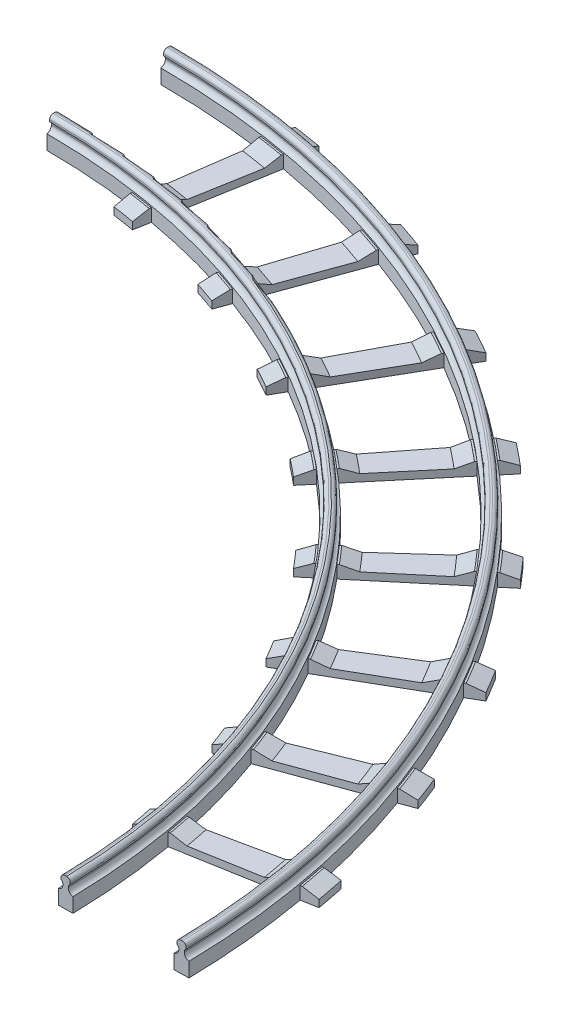
from build123d import *

# Parameters (mm, degrees)
SKETCH_1_W               = 4
SKETCH_1_H               = 21
SKETCH_1_H_2             = 8
EXTRUDE_1_DEPTH          = 4
SKETCH_1_7_W             = 44.5
SKETCH_1_7_H             = 8
EXTRUDE_2_DEPTH          = 3.5
SKETCH_2_W               = 18.5
SKETCH_2_H               = 1.5
CUT_EXTRUDE_1_DEPTH      = 37.7704025
SKETCH_2_3_W             = 2.5
SKETCH_2_3_H             = 1.5
EXTRUDE_4_DEPTH          = 29
FILLET_1_R               = 1
FILLET_2_R               = 1.5
FILLET_3_R               = 1
REVOLVE_2_ANGLE          = 92
CUT_EXTRUDE_5_DEPTH      = 301.959397623
REVOLVE_1_ANGLE          = 2
PATTERN_CIRCULAR_1_COUNT = 10
PATTERN_CIRCULAR_1_ANGLE = 90
CUT_REVOLVE_1_ANGLE      = 1
CUT_REVOLVE_2_ANGLE      = 1
CUT_REVOLVE_3_ANGLE      = 1
CUT_REVOLVE_4_ANGLE      = 1


with BuildPart() as part:
    # 草图1 → 凸台-拉伸1 (new body)
    with BuildSketch(Plane(origin=(0, 0, 0), x_dir=(1, 0, 0), z_dir=(0, 1, 0))):
        with Locations((-15.75, -4)):
            Rectangle(SKETCH_1_W, SKETCH_1_H)
        with Locations((15.75, -4)):
            Rectangle(SKETCH_1_W, SKETCH_1_H)
        with Locations((15.75, 10.5)):
            Rectangle(SKETCH_1_W, SKETCH_1_H_2)
        with Locations((-15.75, 10.5)):
            Rectangle(SKETCH_1_W, SKETCH_1_H_2)
    extrude(amount=EXTRUDE_1_DEPTH)

    # 草图1<7> → 凸台-拉伸2 (add)
    with BuildSketch(Plane(origin=(0, 0, 0), x_dir=(1, 0, 0), z_dir=(0, 1, 0))):
        with Locations((0, 10.5)):
            Rectangle(SKETCH_1_7_W, SKETCH_1_7_H)
    extrude(amount=EXTRUDE_2_DEPTH)

    # 草图2 → 切除-拉伸1 (cut, through all)
    with BuildSketch(Plane(origin=(0, 0, -14.5), x_dir=(-1, 0, 0), z_dir=(0, 0, -1))):
        with Locations((0, 2.75)):
            Rectangle(SKETCH_2_W, SKETCH_2_H)
        Polygon((13.25, 3.5), (9.25, 3.5), (9.25, 2), align=None)
        Polygon((-9.25, 3.5), (-13.25, 3.5), (-9.25, 2), align=None)
        Polygon((-22.25, 3.5), (-22.25, 2), (-18.25, 3.5), align=None)
        Polygon((22.25, 3.5), (18.25, 3.5), (22.25, 2), align=None)
    extrude(amount=-CUT_EXTRUDE_1_DEPTH, mode=Mode.SUBTRACT)

    # 草图2<3> → 凸台-拉伸4 (add, through all)
    with BuildSketch(Plane(origin=(0, 0, -14.5), x_dir=(-1, 0, 0), z_dir=(0, 0, -1))):
        with Locations((-15.75, 7.25)):
            Rectangle(SKETCH_2_3_W, SKETCH_2_3_H)
        Polygon((-15, 6.5), (-16.5, 6.5), (-16.5, 4), (-15.75, 4), (-15, 4), align=None)
        with Locations((15.75, 7.25)):
            Rectangle(SKETCH_2_3_W, SKETCH_2_3_H)
        Polygon((16.5, 6.5), (15, 6.5), (15, 4), (15.75, 4), (16.5, 4), align=None)
    extrude(amount=-EXTRUDE_4_DEPTH)

    # 圆角1
    # the kernel refuses this fillet: 1 mm, written as the material it adds along each edge
    with BuildSketch(Plane(origin=(-16.5, 6.5, -14.5), x_dir=(-1, 0, 0), z_dir=(0, 0, 1)), Plane(origin=(15, 6.5, -14.5), x_dir=(-1, 0, 0), z_dir=(0, 0, 1))) as fillet_1_piece_1:
        with BuildLine():
            CenterArc((1, 0.866025404), FILLET_1_R, 180, 60)
            Line((0, 0.866025404), (-0.02, 0.866025404))
            Line((-0.02, 0.866025404), (-0.02, 0))
            Line((-0.02, 0), (0, -0.02))
            ThreePointArc((0, -0.02), (0.25, -0.02), (0.49, -0.017320508))
            Line((0.49, -0.017320508), (0.5, 0))
        make_face()
    extrude(amount=29)
    with BuildSketch(Plane(origin=(-15, 6.5, -14.5), x_dir=(0, -1, 0), z_dir=(0, 0, 1)), Plane(origin=(16.5, 6.5, -14.5), x_dir=(0, -1, 0), z_dir=(0, 0, 1))) as fillet_1_piece_2:
        with BuildLine():
            CenterArc((0.866025404, 1), FILLET_1_R, 210, 60)
            Line((0, 0.5), (-0.017320508, 0.49))
            ThreePointArc((-0.017320508, 0.49), (-0.02, 0.25), (-0.02, 0))
            Line((-0.02, 0), (0, -0.02))
            Line((0, -0.02), (0.866025404, -0.02))
            Line((0.866025404, -0.02), (0.866025404, 0))
        make_face()
    extrude(amount=29)

    # 圆角2
    # the kernel refuses this fillet: 1.5 mm, written as the material it adds along each edge
    with BuildSketch(Plane(origin=(16.5, 4, -14.5), x_dir=(1, 0, 0), z_dir=(0, 0, 1))) as fillet_2_piece_1:
        with BuildLine():
            CenterArc((1.5, 1.479019946), FILLET_2_R, 180, 80.405931773)
            Line((0, 1.479019946), (-0.03, 1.479019946))
            Line((-0.03, 1.479019946), (-0.03, 0))
            Line((-0.03, 0), (0, -0.03))
            ThreePointArc((0, -0.03), (0.625, -0.03), (1.245, -0.029580399))
            Line((1.245, -0.029580399), (1.25, 0))
        make_face()
    extrude(amount=29)
    with BuildSketch(Plane(origin=(15, 4, -14.5), x_dir=(0, 1, 0), z_dir=(0, 0, 1)), Plane(origin=(-16.5, 4, -14.5), x_dir=(0, 1, 0), z_dir=(0, 0, 1))) as fillet_2_piece_2:
        with BuildLine():
            CenterArc((1.479019946, 1.5), FILLET_2_R, 189.594068227, 80.405931773)
            Line((0, 1.25), (-0.029580399, 1.245))
            ThreePointArc((-0.029580399, 1.245), (-0.03, 0.625), (-0.03, 0))
            Line((-0.03, 0), (0, -0.03))
            Line((0, -0.03), (1.479019946, -0.03))
            Line((1.479019946, -0.03), (1.479019946, 0))
        make_face()
    extrude(amount=29)
    with BuildSketch(Plane(origin=(-15, 4, -14.5), x_dir=(0, 1, 0), z_dir=(0, 0, 1))) as fillet_2_piece_3:
        with BuildLine():
            CenterArc((1.479019946, -1.5), FILLET_2_R, 90, 80.405931773)
            Line((0, -1.25), (-0.029580399, -1.245))
            ThreePointArc((-0.029580399, -1.245), (-0.03, -0.625), (-0.03, 0))
            Line((-0.03, 0), (0, 0.03))
            Line((0, 0.03), (1.479019946, 0.03))
            Line((1.479019946, 0.03), (1.479019946, 0))
        make_face()
    extrude(amount=29)

    # 圆角3
    fillet_3_edges = [part.edges().sort_by_distance(p)[0] for p in [
        (14.5, 8, 0),
        (17, 8, 0),
        (-17, 8, 0),
        (-14.5, 8, 0),
    ]]
    fillet(fillet_3_edges, radius=FILLET_3_R)

    # 草图7 → 旋转2 (revolve)
    with BuildSketch(Plane(origin=(0, 0, -14.5), x_dir=(-1, 0, 0), z_dir=(0, 0, -1))):
        with BuildLine():
            Line((-17.75, 3.5), (-17.75, 0))
            Line((-17.75, 0), (-13.75, 0))
            Line((-13.75, 0), (-13.75, 3.5))
            Line((-13.75, 3.5), (-13.75, 4))
            ThreePointArc((-13.75, 4), (-14.645643924, 4.510774109), (-15, 5.479019946))
            Line((-15, 5.479019946), (-15, 5.633974596))
            ThreePointArc((-15, 5.633974596), (-14.866025404, 6.133974596), (-14.5, 6.5))
            Line((-14.5, 6.5), (-14.5, 7))
            ThreePointArc((-14.5, 7), (-14.792893219, 7.707106781), (-15.5, 8))
            Line((-15.5, 8), (-16, 8))
            ThreePointArc((-16, 8), (-16.707106781, 7.707106781), (-17, 7))
            Line((-17, 7), (-17, 6.5))
            ThreePointArc((-17, 6.5), (-16.633974596, 6.133974596), (-16.5, 5.633974596))
            Line((-16.5, 5.633974596), (-16.5, 5.479019946))
            ThreePointArc((-16.5, 5.479019946), (-16.854356076, 4.510774109), (-17.75, 4))
            Line((-17.75, 4), (-17.75, 3.5))
        make_face()
        with BuildLine():
            Line((13.75, 3.5), (13.75, 0))
            Line((13.75, 0), (17.75, 0))
            Line((17.75, 0), (17.75, 3.5))
            Line((17.75, 3.5), (17.75, 4))
            ThreePointArc((17.75, 4), (16.854356076, 4.510774109), (16.5, 5.479019946))
            Line((16.5, 5.479019946), (16.5, 5.633974596))
            ThreePointArc((16.5, 5.633974596), (16.633974596, 6.133974596), (17, 6.5))
            Line((17, 6.5), (17, 7))
            ThreePointArc((17, 7), (16.707106781, 7.707106781), (16, 8))
            Line((16, 8), (15.5, 8))
            ThreePointArc((15.5, 8), (14.792893219, 7.707106781), (14.5, 7))
            Line((14.5, 7), (14.5, 6.5))
            ThreePointArc((14.5, 6.5), (14.866025404, 6.133974596), (15, 5.633974596))
            Line((15, 5.633974596), (15, 5.479019946))
            ThreePointArc((15, 5.479019946), (14.645643924, 4.510774109), (13.75, 4))
            Line((13.75, 4), (13.75, 3.5))
        make_face()
    revolve(axis=Axis((-200, 10, -14.5), (0, 1, 0)), revolution_arc=REVOLVE_2_ANGLE)

    # 草图5<2> → 切除-拉伸5 (cut, through all)
    with BuildSketch(Plane(origin=(0, 0, -14.5), x_dir=(-1, 0, 0), z_dir=(0, 0, -1))):
        with BuildLine():
            Line((17, 6.5), (17, 7))
            ThreePointArc((17, 7), (16.707106781, 7.707106781), (16, 8))
            Line((16, 8), (15.5, 8))
            ThreePointArc((15.5, 8), (14.792893219, 7.707106781), (14.5, 7))
            Line((14.5, 7), (14.5, 6.5))
            ThreePointArc((14.5, 6.5), (14.866025404, 6.133974596), (15, 5.633974596))
            Line((15, 5.633974596), (15, 5.479019946))
            ThreePointArc((15, 5.479019946), (14.645643924, 4.510774109), (13.75, 4))
            Line((13.75, 4), (13.75, 3.5))
            Line((13.75, 3.5), (13.25, 3.5))
            Line((13.25, 3.5), (9.25, 2))
            Line((9.25, 2), (-9.25, 2))
            Line((-9.25, 2), (-13.25, 3.5))
            Line((-13.25, 3.5), (-13.75, 3.5))
            Line((-13.75, 3.5), (-13.75, 4))
            ThreePointArc((-13.75, 4), (-14.645643924, 4.510774109), (-15, 5.479019946))
            Line((-15, 5.479019946), (-15, 5.633974596))
            ThreePointArc((-15, 5.633974596), (-14.866025404, 6.133974596), (-14.5, 6.5))
            Line((-14.5, 6.5), (-14.5, 7))
            ThreePointArc((-14.5, 7), (-14.792893219, 7.707106781), (-15.5, 8))
            Line((-15.5, 8), (-16, 8))
            ThreePointArc((-16, 8), (-16.707106781, 7.707106781), (-17, 7))
            Line((-17, 7), (-17, 6.5))
            ThreePointArc((-17, 6.5), (-16.633974596, 6.133974596), (-16.5, 5.633974596))
            Line((-16.5, 5.633974596), (-16.5, 5.479019946))
            ThreePointArc((-16.5, 5.479019946), (-16.854356076, 4.510774109), (-17.75, 4))
            Line((-17.75, 4), (-17.75, 3.5))
            Line((-17.75, 3.5), (-18.25, 3.5))
            Line((-18.25, 3.5), (-22.25, 2))
            Line((-22.25, 2), (-22.25, 0))
            Line((-22.25, 0), (22.25, 0))
            Line((22.25, 0), (22.25, 2))
            Line((22.25, 2), (18.25, 3.5))
            Line((18.25, 3.5), (17.75, 3.5))
            Line((17.75, 3.5), (17.75, 4))
            ThreePointArc((17.75, 4), (16.854356076, 4.510774109), (16.5, 5.479019946))
            Line((16.5, 5.479019946), (16.5, 5.633974596))
            ThreePointArc((16.5, 5.633974596), (16.633974596, 6.133974596), (17, 6.5))
        make_face()
    extrude(amount=-CUT_EXTRUDE_5_DEPTH, mode=Mode.SUBTRACT)


with BuildPart() as cut_extrude_5_piece_1:
    # of the separate pieces the step leaves, piece 1, a body of its own (cut_extrude_5_pieces)
    add(part.part.solids().sort_by_distance((13.75, 0, -14.5))[0])



with BuildPart() as cut_extrude_5_piece_2:
    # of the separate pieces the step leaves, piece 2, a body of its own (cut_extrude_5_pieces)
    add(part.part.solids().sort_by_distance((-13.75, 4, -14.5))[0])


with BuildPart() as cut_extrude_5_piece_1_1:
    add(cut_extrude_5_piece_1.part)

    add(cut_extrude_5_piece_2.part)  # 旋转1 merges 切除-拉伸5 piece 2
    # 草图5 → 旋转1 (revolve)
    with BuildSketch(Plane(origin=(0, 0, -14.5), x_dir=(-1, 0, 0), z_dir=(0, 0, -1))):
        with BuildLine():
            Line((17, 6.5), (17, 7))
            ThreePointArc((17, 7), (16.707106781, 7.707106781), (16, 8))
            Line((16, 8), (15.5, 8))
            ThreePointArc((15.5, 8), (14.792893219, 7.707106781), (14.5, 7))
            Line((14.5, 7), (14.5, 6.5))
            ThreePointArc((14.5, 6.5), (14.866025404, 6.133974596), (15, 5.633974596))
            Line((15, 5.633974596), (15, 5.479019946))
            ThreePointArc((15, 5.479019946), (14.645643924, 4.510774109), (13.75, 4))
            Line((13.75, 4), (13.75, 3.5))
            Line((13.75, 3.5), (13.25, 3.5))
            Line((13.25, 3.5), (9.25, 2))
            Line((9.25, 2), (-9.25, 2))
            Line((-9.25, 2), (-13.25, 3.5))
            Line((-13.25, 3.5), (-13.75, 3.5))
            Line((-13.75, 3.5), (-13.75, 4))
            ThreePointArc((-13.75, 4), (-14.645643924, 4.510774109), (-15, 5.479019946))
            Line((-15, 5.479019946), (-15, 5.633974596))
            ThreePointArc((-15, 5.633974596), (-14.866025404, 6.133974596), (-14.5, 6.5))
            Line((-14.5, 6.5), (-14.5, 7))
            ThreePointArc((-14.5, 7), (-14.792893219, 7.707106781), (-15.5, 8))
            Line((-15.5, 8), (-16, 8))
            ThreePointArc((-16, 8), (-16.707106781, 7.707106781), (-17, 7))
            Line((-17, 7), (-17, 6.5))
            ThreePointArc((-17, 6.5), (-16.633974596, 6.133974596), (-16.5, 5.633974596))
            Line((-16.5, 5.633974596), (-16.5, 5.479019946))
            ThreePointArc((-16.5, 5.479019946), (-16.854356076, 4.510774109), (-17.75, 4))
            Line((-17.75, 4), (-17.75, 3.5))
            Line((-17.75, 3.5), (-18.25, 3.5))
            Line((-18.25, 3.5), (-22.25, 2))
            Line((-22.25, 2), (-22.25, 0))
            Line((-22.25, 0), (22.25, 0))
            Line((22.25, 0), (22.25, 2))
            Line((22.25, 2), (18.25, 3.5))
            Line((18.25, 3.5), (17.75, 3.5))
            Line((17.75, 3.5), (17.75, 4))
            ThreePointArc((17.75, 4), (16.854356076, 4.510774109), (16.5, 5.479019946))
            Line((16.5, 5.479019946), (16.5, 5.633974596))
            ThreePointArc((16.5, 5.633974596), (16.633974596, 6.133974596), (17, 6.5))
        make_face()
    revolve_1 = revolve(axis=Axis((-200, 10, -14.5), (0, 1, 0)), revolution_arc=REVOLVE_1_ANGLE)

    # 阵列(圆周)1: 旋转1 ×10 about axis
    pattern_circular_1_axis = Axis((-200, 0, -14.5), (0, 1, 0))
    for i in range(1, PATTERN_CIRCULAR_1_COUNT):
        add(revolve_1.rotate(pattern_circular_1_axis, i * PATTERN_CIRCULAR_1_ANGLE / (PATTERN_CIRCULAR_1_COUNT - 1)))

    # 草图8 → 切除-旋转1 (revolve, cut)
    with BuildSketch(Plane.XY.offset(-14.5)):
        with BuildLine():
            Line((-22.25, 2), (-22.25, 0))
            Line((-22.25, 0), (22.25, 0))
            Line((22.25, 0), (22.25, 2))
            Line((22.25, 2), (18.25, 3.5))
            Line((18.25, 3.5), (17.75, 3.5))
            Line((17.75, 3.5), (17.75, 4))
            ThreePointArc((17.75, 4), (16.854356076, 4.510774109), (16.5, 5.479019946))
            Line((16.5, 5.479019946), (16.5, 5.633974596))
            ThreePointArc((16.5, 5.633974596), (16.633974596, 6.133974596), (17, 6.5))
            Line((17, 6.5), (17, 7))
            ThreePointArc((17, 7), (16.707106781, 7.707106781), (16, 8))
            Line((16, 8), (15.5, 8))
            ThreePointArc((15.5, 8), (14.792893219, 7.707106781), (14.5, 7))
            Line((14.5, 7), (14.5, 6.5))
            ThreePointArc((14.5, 6.5), (14.866025404, 6.133974596), (15, 5.633974596))
            Line((15, 5.633974596), (15, 5.479019946))
            ThreePointArc((15, 5.479019946), (14.645643924, 4.510774109), (13.75, 4))
            Line((13.75, 4), (13.75, 3.5))
            Line((13.75, 3.5), (13.25, 3.5))
            Line((13.25, 3.5), (9.25, 2))
            Line((9.25, 2), (-9.25, 2))
            Line((-9.25, 2), (-13.25, 3.5))
            Line((-13.25, 3.5), (-13.75, 3.5))
            Line((-13.75, 3.5), (-13.75, 4))
            ThreePointArc((-13.75, 4), (-14.645643924, 4.510774109), (-15, 5.479019946))
            Line((-15, 5.479019946), (-15, 5.633974596))
            ThreePointArc((-15, 5.633974596), (-14.866025404, 6.133974596), (-14.5, 6.5))
            Line((-14.5, 6.5), (-14.5, 7))
            ThreePointArc((-14.5, 7), (-14.792893219, 7.707106781), (-15.5, 8))
            Line((-15.5, 8), (-16, 8))
            ThreePointArc((-16, 8), (-16.707106781, 7.707106781), (-17, 7))
            Line((-17, 7), (-17, 6.5))
            ThreePointArc((-17, 6.5), (-16.633974596, 6.133974596), (-16.5, 5.633974596))
            Line((-16.5, 5.633974596), (-16.5, 5.479019946))
            ThreePointArc((-16.5, 5.479019946), (-16.854356076, 4.510774109), (-17.75, 4))
            Line((-17.75, 4), (-17.75, 3.5))
            Line((-17.75, 3.5), (-18.25, 3.5))
            Line((-18.25, 3.5), (-22.25, 2))
        make_face()
    revolve(axis=Axis((-200, 10, -14.5), (0, 1, 0)), revolution_arc=CUT_REVOLVE_1_ANGLE, mode=Mode.SUBTRACT)

    # 草图9 → 切除-旋转2 (revolve, cut)
    with BuildSketch(Plane(origin=(-199.250670591, 0, 6.957986739), x_dir=(0.034899496702504584, 0, 0.9993908270190957), z_dir=(-0.9993908270190957, 0, 0.034899496702504584))):
        with BuildLine():
            Line((-243.721066332, 0), (-199.221066332, 0))
            Line((-199.221066332, 0), (-199.221066332, 2))
            Line((-199.221066332, 2), (-203.221066332, 3.5))
            Line((-203.221066332, 3.5), (-203.721066332, 3.5))
            Line((-203.721066332, 3.5), (-203.721066332, 4))
            ThreePointArc((-203.721066332, 4), (-204.616710256, 4.510774109), (-204.971066332, 5.479019946))
            Line((-204.971066332, 5.479019946), (-204.971066332, 5.633974596))
            ThreePointArc((-204.971066332, 5.633974596), (-204.837091736, 6.133974596), (-204.471066332, 6.5))
            Line((-204.471066332, 6.5), (-204.471066332, 7))
            ThreePointArc((-204.471066332, 7), (-204.763959551, 7.707106781), (-205.471066332, 8))
            Line((-205.471066332, 8), (-205.971066332, 8))
            ThreePointArc((-205.971066332, 8), (-206.678173113, 7.707106781), (-206.971066332, 7))
            Line((-206.971066332, 7), (-206.971066332, 6.5))
            ThreePointArc((-206.971066332, 6.5), (-206.605040928, 6.133974596), (-206.471066332, 5.633974596))
            Line((-206.471066332, 5.633974596), (-206.471066332, 5.479019946))
            ThreePointArc((-206.471066332, 5.479019946), (-206.825422409, 4.510774109), (-207.721066332, 4))
            Line((-207.721066332, 4), (-207.721066332, 3.5))
            Line((-207.721066332, 3.5), (-208.221066332, 3.5))
            Line((-208.221066332, 3.5), (-212.221066332, 2))
            Line((-212.221066332, 2), (-230.721066332, 2))
            Line((-230.721066332, 2), (-234.721066332, 3.5))
            Line((-234.721066332, 3.5), (-235.221066332, 3.5))
            Line((-235.221066332, 3.5), (-235.221066332, 4))
            ThreePointArc((-235.221066332, 4), (-236.116710256, 4.510774109), (-236.471066332, 5.479019946))
            Line((-236.471066332, 5.479019946), (-236.471066332, 5.633974596))
            ThreePointArc((-236.471066332, 5.633974596), (-236.337091736, 6.133974596), (-235.971066332, 6.5))
            Line((-235.971066332, 6.5), (-235.971066332, 7))
            ThreePointArc((-235.971066332, 7), (-236.263959551, 7.707106781), (-236.971066332, 8))
            Line((-236.971066332, 8), (-237.471066332, 8))
            ThreePointArc((-237.471066332, 8), (-238.178173113, 7.707106781), (-238.471066332, 7))
            Line((-238.471066332, 7), (-238.471066332, 6.5))
            ThreePointArc((-238.471066332, 6.5), (-238.105040928, 6.133974596), (-237.971066332, 5.633974596))
            Line((-237.971066332, 5.633974596), (-237.971066332, 5.479019946))
            ThreePointArc((-237.971066332, 5.479019946), (-238.325422409, 4.510774109), (-239.221066332, 4))
            Line((-239.221066332, 4), (-239.221066332, 3.5))
            Line((-239.221066332, 3.5), (-239.721066332, 3.5))
            Line((-239.721066332, 3.5), (-243.721066332, 2))
            Line((-243.721066332, 2), (-243.721066332, 0))
        make_face()
    revolve(axis=Axis((-200, 10, -14.5), (0, -1, 0)), revolution_arc=CUT_REVOLVE_2_ANGLE, mode=Mode.SUBTRACT)

    # 草图10 → 切除-旋转3 (revolve, cut)
    with BuildSketch(Plane(origin=(-0.313938649, 0, -17.985533166), x_dir=(0.9998476951563913, 0, -0.01745240643728355), z_dir=(0.01745240643728355, 0, 0.9998476951563913))):
        Polygon((-17.466479138, 3.5), (-17.466479138, 0), (-21.966479138, 0), (-21.966479138, 2), (-17.966479138, 3.5), align=None)
        Polygon((-13.466479138, 3.5), (-13.466479138, 0), (14.033520862, 0), (14.033520862, 3.5), (13.533520862, 3.5), (9.533520862, 2), (-8.966479138, 2), (-12.966479138, 3.5), align=None)
        Polygon((18.033520862, 3.5), (18.033520862, 0), (22.533520862, 0), (22.533520862, 2), (18.533520862, 3.5), align=None)
    revolve(axis=Axis((-200, 10, -14.5), (0, 1, 0)), revolution_arc=CUT_REVOLVE_3_ANGLE, mode=Mode.SUBTRACT)

    # 草图11 → 切除-旋转4 (revolve, cut)
    with BuildSketch(Plane(origin=(-199.686061351, 0, 3.485533166), x_dir=(0.01745240643728707, 0, 0.9998476951563913), z_dir=(-0.9998476951563913, 0, 0.01745240643728707))):
        with BuildLine():
            Line((-195.738272867, 0), (-195.738272867, 2))
            Line((-195.738272867, 2), (-199.738272867, 3.5))
            Line((-199.738272867, 3.5), (-200.238272867, 3.5))
            Line((-200.238272867, 3.5), (-200.238272867, 4))
            ThreePointArc((-200.238272867, 4), (-201.133916791, 4.510774109), (-201.488272867, 5.479019946))
            Line((-201.488272867, 5.479019946), (-201.488272867, 5.633974596))
            ThreePointArc((-201.488272867, 5.633974596), (-201.354298271, 6.133974596), (-200.988272867, 6.5))
            Line((-200.988272867, 6.5), (-200.988272867, 7))
            ThreePointArc((-200.988272867, 7), (-201.281166086, 7.707106781), (-201.988272867, 8))
            Line((-201.988272867, 8), (-202.488272867, 8))
            ThreePointArc((-202.488272867, 8), (-203.195379648, 7.707106781), (-203.488272867, 7))
            Line((-203.488272867, 7), (-203.488272867, 6.5))
            ThreePointArc((-203.488272867, 6.5), (-203.122247463, 6.133974596), (-202.988272867, 5.633974596))
            Line((-202.988272867, 5.633974596), (-202.988272867, 5.479019946))
            ThreePointArc((-202.988272867, 5.479019946), (-203.342628943, 4.510774109), (-204.238272867, 4))
            Line((-204.238272867, 4), (-204.238272867, 3.5))
            Line((-204.238272867, 3.5), (-204.738272867, 3.5))
            Line((-204.738272867, 3.5), (-208.738272867, 2))
            Line((-208.738272867, 2), (-227.238272867, 2))
            Line((-227.238272867, 2), (-231.238272867, 3.5))
            Line((-231.238272867, 3.5), (-231.738272867, 3.5))
            Line((-231.738272867, 3.5), (-231.738272867, 4))
            ThreePointArc((-231.738272867, 4), (-232.633916791, 4.510774109), (-232.988272867, 5.479019946))
            Line((-232.988272867, 5.479019946), (-232.988272867, 5.633974596))
            ThreePointArc((-232.988272867, 5.633974596), (-232.854298271, 6.133974596), (-232.488272867, 6.5))
            Line((-232.488272867, 6.5), (-232.488272867, 7))
            ThreePointArc((-232.488272867, 7), (-232.781166086, 7.707106781), (-233.488272867, 8))
            Line((-233.488272867, 8), (-233.988272867, 8))
            ThreePointArc((-233.988272867, 8), (-234.695379648, 7.707106781), (-234.988272867, 7))
            Line((-234.988272867, 7), (-234.988272867, 6.5))
            ThreePointArc((-234.988272867, 6.5), (-234.622247463, 6.133974596), (-234.488272867, 5.633974596))
            Line((-234.488272867, 5.633974596), (-234.488272867, 5.479019946))
            ThreePointArc((-234.488272867, 5.479019946), (-234.842628943, 4.510774109), (-235.738272867, 4))
            Line((-235.738272867, 4), (-235.738272867, 3.5))
            Line((-235.738272867, 3.5), (-236.238272867, 3.5))
            Line((-236.238272867, 3.5), (-240.238272867, 2))
            Line((-240.238272867, 2), (-240.238272867, 0))
            Line((-240.238272867, 0), (-195.738272867, 0))
        make_face()
    revolve(axis=Axis((-200, 10, -14.5), (0, -1, 0)), revolution_arc=CUT_REVOLVE_4_ANGLE, mode=Mode.SUBTRACT)


solid = cut_extrude_5_piece_1_1.part
